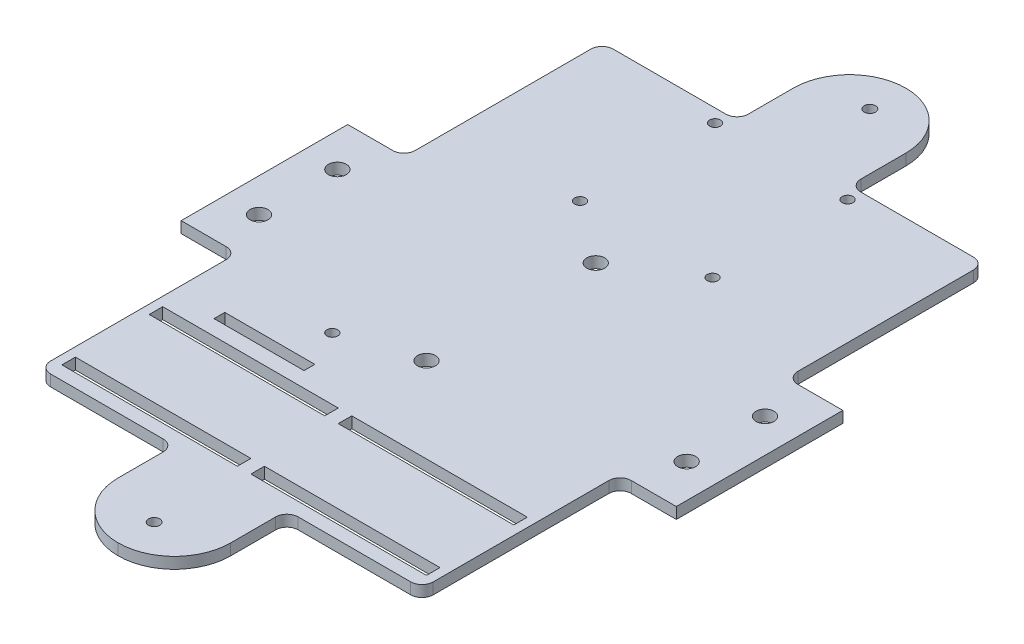
from build123d import *

# Parameters (mm, degrees)
BOSS_EXTRUDE1_DEPTH = 3.175
FILLET1_R           = 3.175
FILLET2_R           = 15.875
SKETCH2_R           = 1.5875
CUT_EXTRUDE1_DEPTH  = 228.228874156
SKETCH3_R           = 2.5273
CUT_EXTRUDE2_DEPTH  = 228.228874156
SKETCH4_R           = 2.5273
CUT_EXTRUDE3_DEPTH  = 228.228874156
SKETCH7_R           = 1.524
CUT_EXTRUDE6_DEPTH  = 228.228874156
SKETCH8_R           = 1.524
CUT_EXTRUDE7_DEPTH  = 228.228874156
SKETCH10_W          = 25.4
SKETCH10_H          = 3.048
CUT_EXTRUDE9_DEPTH  = 228.228874156
SKETCH11_W          = 49.53
SKETCH11_H          = 3.81
CUT_EXTRUDE10_DEPTH = 228.228874156


with BuildPart() as part:
    # Sketch1 → Boss-Extrude1 (new body)
    with BuildSketch(Plane(origin=(0, 0, 0), x_dir=(1, 0, 0), z_dir=(0, 1, 0))):
        Polygon((0, 102.87), (0, 158.75), (38.1, 158.75), (38.1, 190.5), (69.85, 190.5), (69.85, 158.75), (107.95, 158.75), (107.95, 102.87), (123.825, 102.87), (123.825, 55.88), (107.95, 55.88), (107.95, 0), (69.85, 0), (69.85, -31.75), (38.1, -31.75), (38.1, 0), (0, 0), (0, 55.88), (-15.875, 55.88), (-15.875, 102.87), align=None)
    extrude(amount=BOSS_EXTRUDE1_DEPTH)

    # Fillet1
    fillet1_edges = [part.edges().sort_by_distance(p)[0] for p in [
        (0, 1.5875, -55.88),
        (0, 1.5875, -102.87),
        (0, 1.5875, -158.75),
        (38.1, 1.5875, -158.75),
        (69.85, 1.5875, -158.75),
        (107.95, 1.5875, -158.75),
        (107.95, 1.5875, -102.87),
        (107.95, 1.5875, -55.88),
        (107.95, 1.5875, 0),
        (69.85, 1.5875, 0),
        (38.1, 1.5875, 0),
        (0, 1.5875, 0),
    ]]
    fillet(fillet1_edges, radius=FILLET1_R)

    # Fillet2
    fillet2_edges = [part.edges().sort_by_distance(p)[0] for p in [
        (38.1, 1.5875, 31.75),
        (69.85, 1.5875, 31.75),
        (69.85, 1.5875, -190.5),
        (38.1, 1.5875, -190.5),
    ]]
    fillet(fillet2_edges, radius=FILLET2_R - 0.0001)  # a hair under: the kernel refuses the full size

    # Sketch2 → Cut-Extrude1 (cut, through all)
    with BuildSketch(Plane(origin=(0, 3.175, 0), x_dir=(1, 0, 0), z_dir=(0, 1, 0))):
        with Locations(Location((53.975, 180.34, 0), (0, 0, 270))):
            Circle(SKETCH2_R)
        with Locations(Location((53.975, -21.59, 0), (0, 0, 270))):
            Circle(SKETCH2_R)
    extrude(amount=-CUT_EXTRUDE1_DEPTH, mode=Mode.SUBTRACT)

    # Sketch3 → Cut-Extrude2 (cut, through all)
    with BuildSketch(Plane.XZ):
        with Locations(Location((-6.35, -68.326, 0), (0, 0, 270))):
            Circle(SKETCH3_R)
        with Locations(Location((-6.35, -90.424, 0), (0, 0, 270))):
            Circle(SKETCH3_R)
        with Locations(Location((114.3, -68.326, 0), (0, 0, 270))):
            Circle(SKETCH3_R)
        with Locations(Location((114.3, -90.424, 0), (0, 0, 270))):
            Circle(SKETCH3_R)
    extrude(amount=-CUT_EXTRUDE2_DEPTH, mode=Mode.SUBTRACT)

    # Sketch4 → Cut-Extrude3 (cut, through all)
    with BuildSketch(Plane.XZ):
        with Locations(Location((52.959, -56.261, 0), (0, 0, 270))):
            Circle(SKETCH4_R)
        with Locations(Location((52.959, -104.013, 0), (0, 0, 270))):
            Circle(SKETCH4_R)
    extrude(amount=-CUT_EXTRUDE3_DEPTH, mode=Mode.SUBTRACT)

    # Sketch7 → Cut-Extrude6 (cut, through all)
    with BuildSketch(Plane.XZ):
        with Locations(Location((32.87141, -49.784, 0), (0, 0, 270))):
            Circle(SKETCH7_R)
    extrude(amount=-CUT_EXTRUDE6_DEPTH, mode=Mode.SUBTRACT)

    # Sketch8 → Cut-Extrude7 (cut, through all)
    with BuildSketch(Plane.XZ):
        with Locations(Location((35.60064, -116.9416, 0), (0, 0, 270))):
            Circle(SKETCH8_R)
        with Locations(Location((35.60064, -155.0416, 0), (0, 0, 270))):
            Circle(SKETCH8_R)
        with Locations(Location((72.9996, -116.9416, 0), (0, 0, 270))):
            Circle(SKETCH8_R)
        with Locations(Location((72.9996, -155.0416, 0), (0, 0, 270))):
            Circle(SKETCH8_R)
    extrude(amount=-CUT_EXTRUDE7_DEPTH, mode=Mode.SUBTRACT)

    # Sketch10 → Cut-Extrude9 (cut, through all)
    with BuildSketch(Plane.XZ):
        with Locations((25.4, -38.1)):
            Rectangle(SKETCH10_W, SKETCH10_H)
    extrude(amount=-CUT_EXTRUDE9_DEPTH, mode=Mode.SUBTRACT)

    # Sketch11 → Cut-Extrude10 (cut, through all)
    with BuildSketch(Plane.XZ):
        with Locations((27.305, -5.715)):
            Rectangle(SKETCH11_W, SKETCH11_H)
        with Locations((27.305, -30.353)):
            Rectangle(SKETCH11_W, SKETCH11_H)
        with Locations((80.645, -5.715)):
            Rectangle(SKETCH11_W, SKETCH11_H)
        with Locations((80.645, -30.353)):
            Rectangle(SKETCH11_W, SKETCH11_H)
    extrude(amount=-CUT_EXTRUDE10_DEPTH, mode=Mode.SUBTRACT)


solid = part.part
